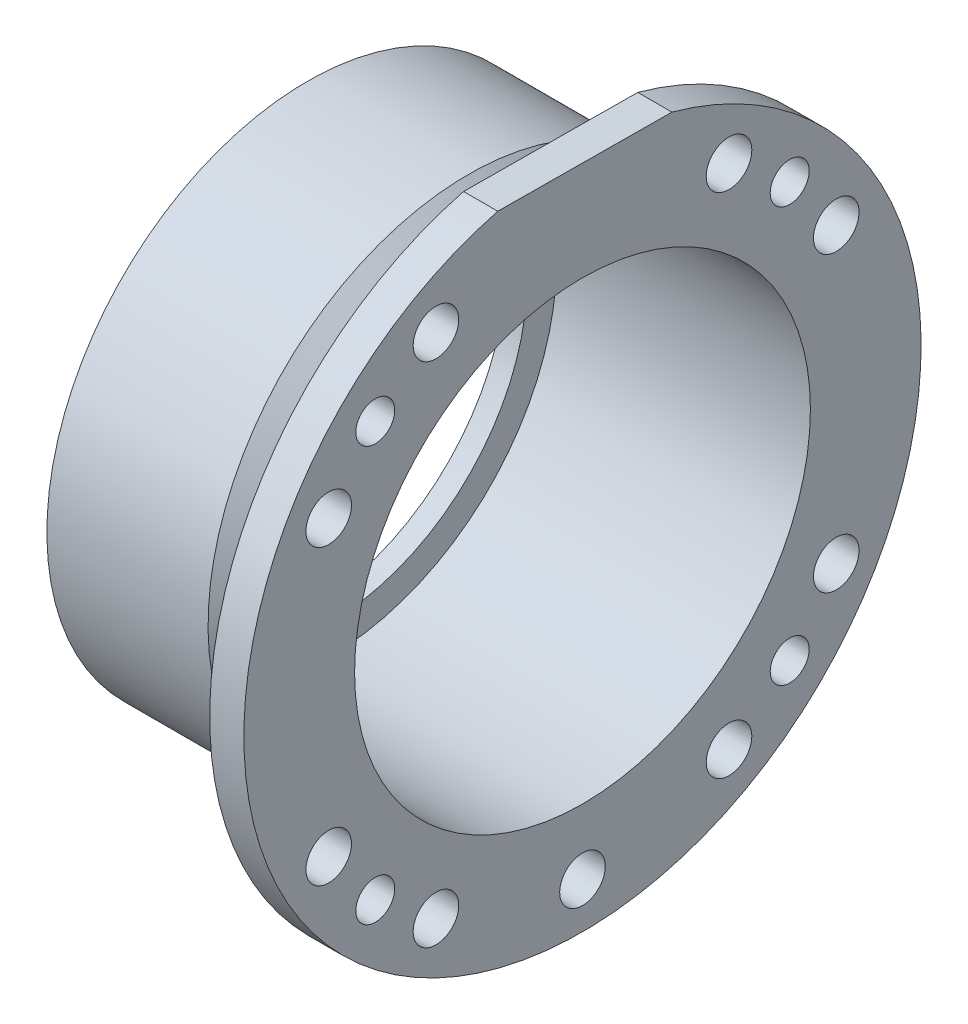
from build123d import *

# Parameters (mm, degrees)
ENL_V_MAT_EXTRU_2_DEPTH      = 165.645072808
ENL_V_MAT_EXTRU_2_DEPTH_BACK = 165.645072808
ESQUISSE3_R                  = 7
ESQUISSE3_R_2                = 5.983
ESQUISSE3_R_3                = 61
ESQUISSE5_R                  = 70
ENL_V_MAT_EXTRU_4_DEPTH      = 78


with BuildPart() as part:
    # Esquisse1 → Révolution2 (revolve)
    with BuildSketch(Plane.XY):
        Polygon((42.25, 0), (42.25, 104), (31.75, 104), (31.75, 80), (21.75, 80), (16.75, 75), (12.25, 75), (7.25, 80), (-42.25, 80), (-42.25, 0), align=None)
    revolve(axis=Axis((-42.25, 0, 0), (1, 0, 0)))

    # Esquisse3 → Enlèv. mat.-Extru.2 (cut, two sides: drawn at the far end of the back side and taken through both)
    with BuildSketch(Plane.ZY.offset(-31.75).offset(-ENL_V_MAT_EXTRU_2_DEPTH_BACK)):
        with Locations((-45, 77.942286341)):
            Circle(ESQUISSE3_R)
        with Locations((-63.639610307, 63.639610307)):
            Circle(ESQUISSE3_R_2)
        with Locations((-77.942286341, 45)):
            Circle(ESQUISSE3_R)
        with Locations((45, 77.942286341)):
            Circle(ESQUISSE3_R)
        with Locations((63.639610307, 63.639610307)):
            Circle(ESQUISSE3_R_2)
        with Locations((77.942286341, 45)):
            Circle(ESQUISSE3_R)
        with Locations((77.942286341, -45)):
            Circle(ESQUISSE3_R)
        with Locations((63.639610307, -63.639610307)):
            Circle(ESQUISSE3_R_2)
        with Locations((45, -77.942286341)):
            Circle(ESQUISSE3_R)
        with Locations((-45, -77.942286341)):
            Circle(ESQUISSE3_R)
        with Locations((-63.639610307, -63.639610307)):
            Circle(ESQUISSE3_R_2)
        with Locations((-77.942286341, -45)):
            Circle(ESQUISSE3_R)
        with Locations((0, -90)):
            Circle(ESQUISSE3_R)
        Circle(ESQUISSE3_R_3)
        with BuildLine():
            Line((-27.486678638, 100.301956598), (26.018903613, 100.692684217))
            ThreePointArc((26.018903613, 100.692684217), (-0.759445784, 103.997227089), (-27.486678638, 100.301956598))
        make_face()
    extrude(amount=ENL_V_MAT_EXTRU_2_DEPTH + ENL_V_MAT_EXTRU_2_DEPTH_BACK, mode=Mode.SUBTRACT)

    # Esquisse5 → Enlèv. mat.-Extru.4 (cut)
    with BuildSketch(Plane(origin=(42.25, 0, 0), x_dir=(0, 0, -1), z_dir=(1, 0, 0))):
        Circle(ESQUISSE5_R)
    extrude(amount=-ENL_V_MAT_EXTRU_4_DEPTH, mode=Mode.SUBTRACT)


solid = part.part
